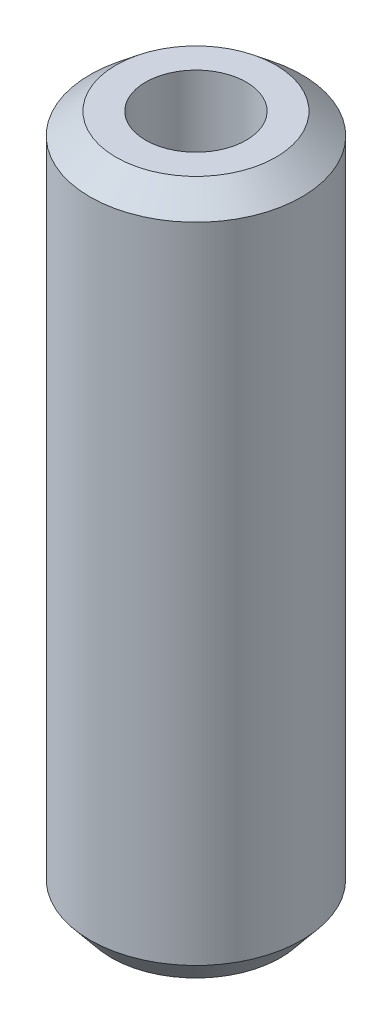
from build123d import *
from OCP.BRepFilletAPI import BRepFilletAPI_MakeChamfer

# Parameters (mm, degrees)
SKETCH1_R           = 22.5
BOSS_EXTRUDE1_DEPTH = 146.788859649
SKETCH2_R           = 10.695183191
CUT_EXTRUDE1_DEPTH  = 151.198100244
CHAMFER1_SIZE       = 4.535473764
CHAMFER1_SIZE2      = 5.51841156


with BuildPart() as part:
    # Sketch1 → Boss-Extrude1 (new body)
    with BuildSketch(Plane(origin=(0, 0, 0), x_dir=(1, 0, 0), z_dir=(0, 1, 0))):
        Circle(SKETCH1_R)
    extrude(amount=BOSS_EXTRUDE1_DEPTH)

    # Sketch2 → Cut-Extrude1 (cut, through all)
    with BuildSketch(Plane(origin=(0, 0, 0), x_dir=(1, 0, 0), z_dir=(0, 1, 0))):
        Circle(SKETCH2_R)
    extrude(amount=CUT_EXTRUDE1_DEPTH, mode=Mode.SUBTRACT)

    # Chamfer1: one chamfer whose edges measure the first distance from different faces: ONE call of the kernel's chamfer builder (chamfer() names one face for all edges)
    chamfer1_edges_1 = [part.edges().sort_by_distance(p)[0] for p in [
        (-22.5, 146.788859649, 0),
    ]]
    chamfer1_side_1 = [part.faces().sort_by_distance(p)[0] for p in [
        (-22.5, 73.394429824, 0),
    ]]
    chamfer1_edges_2 = [part.edges().sort_by_distance(p)[0] for p in [
        (-22.5, 0, 0),
    ]]
    chamfer1_side_2 = [part.faces().sort_by_distance(p)[0] for p in [
        (-21.863603897, 0, 0),
    ]]
    chamfer1 = BRepFilletAPI_MakeChamfer(part.part.solid().wrapped)
    for e in chamfer1_edges_1:
        chamfer1.Add(CHAMFER1_SIZE, CHAMFER1_SIZE2, e.wrapped, chamfer1_side_1[0].wrapped)  # the first distance lies on this face
    for e in chamfer1_edges_2:
        chamfer1.Add(CHAMFER1_SIZE, CHAMFER1_SIZE2, e.wrapped, chamfer1_side_2[0].wrapped)  # the first distance lies on this face
    add(Compound.cast(chamfer1.Shape()), mode=Mode.REPLACE)


solid = part.part
